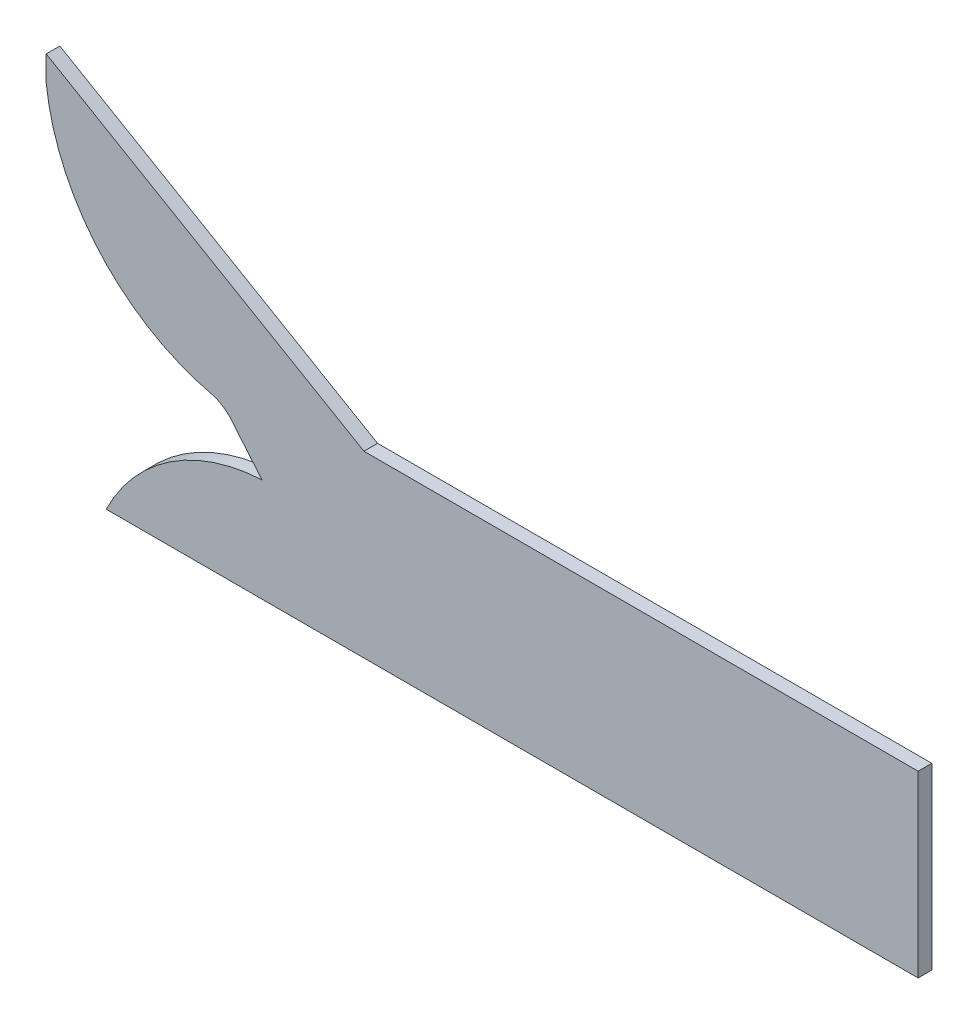
from build123d import *

# Parameters (mm, degrees)
BOSS_EXTRUDE1_DEPTH = 33.45
CAVITY3_DEPTH       = 33.45
CUT_EXTRUDE2_REACH  = 1606.713


# Read off the part's stored shape, not the designer's step: Cavity3
with BuildPart() as part:
    # Sketch1 → Boss-Extrude1 (new body)
    with BuildSketch(Plane.XY):
        Polygon((-678.5, 219.25), (-1456.5, 672.75), (-1456.5, -219.25), (-678.5, -219.25), (678.5, -219.25), (678.5, 219.25), align=None)
    extrude(amount=BOSS_EXTRUDE1_DEPTH)

    # Cavity3 outline → Cavity3 (cut)
    with BuildSketch(Plane.XY):
        with BuildLine():
            Line((-1456.5, -202.506493086), (-1300.878272365, -202.506493086))
            ThreePointArc((-1300.878272365, -202.506493086), (-1145.343683701, -35.513747144), (-927.890567992, 33.708560944))
            Line((-927.890567992, 33.708560944), (-994.109648548, 112.218170508))
            ThreePointArc((-994.109648548, 112.218170508), (-1017.687293376, 137.407064936), (-1048.421985466, 153.083940911))
            ThreePointArc((-1048.421985466, 153.083940911), (-1325.171989397, 317.426039094), (-1456.5, 611.282881012))
            Line((-1456.5, 611.282881012), (-1456.5, -202.506493086))
        make_face()
    extrude(amount=CAVITY3_DEPTH, mode=Mode.SUBTRACT)

    # Sketch6 → Cut-Extrude2 (cut, up to next)
    with BuildSketch(Plane.XY.offset(33.45), mode=Mode.PRIVATE) as cut_extrude2_sk1:
        with BuildLine():
            Line((-1300.878272365, -202.506493086), (-1456.5, -202.506493086))
            Line((-1456.5, -202.506493086), (-1456.5, -219.25))
            Line((-1456.5, -219.25), (-1309.43889328, -219.25))
            ThreePointArc((-1309.43889328, -219.25), (-1305.246054091, -210.833524229), (-1300.878272365, -202.506493086))
        make_face()
    cut_extrude2_tool1 = extrude(cut_extrude2_sk1.sketch, amount=-CUT_EXTRUDE2_REACH, mode=Mode.PRIVATE) & part.part
    add(cut_extrude2_tool1.solids().sort_by_distance((-1380.845886, -210.799292, 33.45))[0], mode=Mode.SUBTRACT)


solid = part.part
